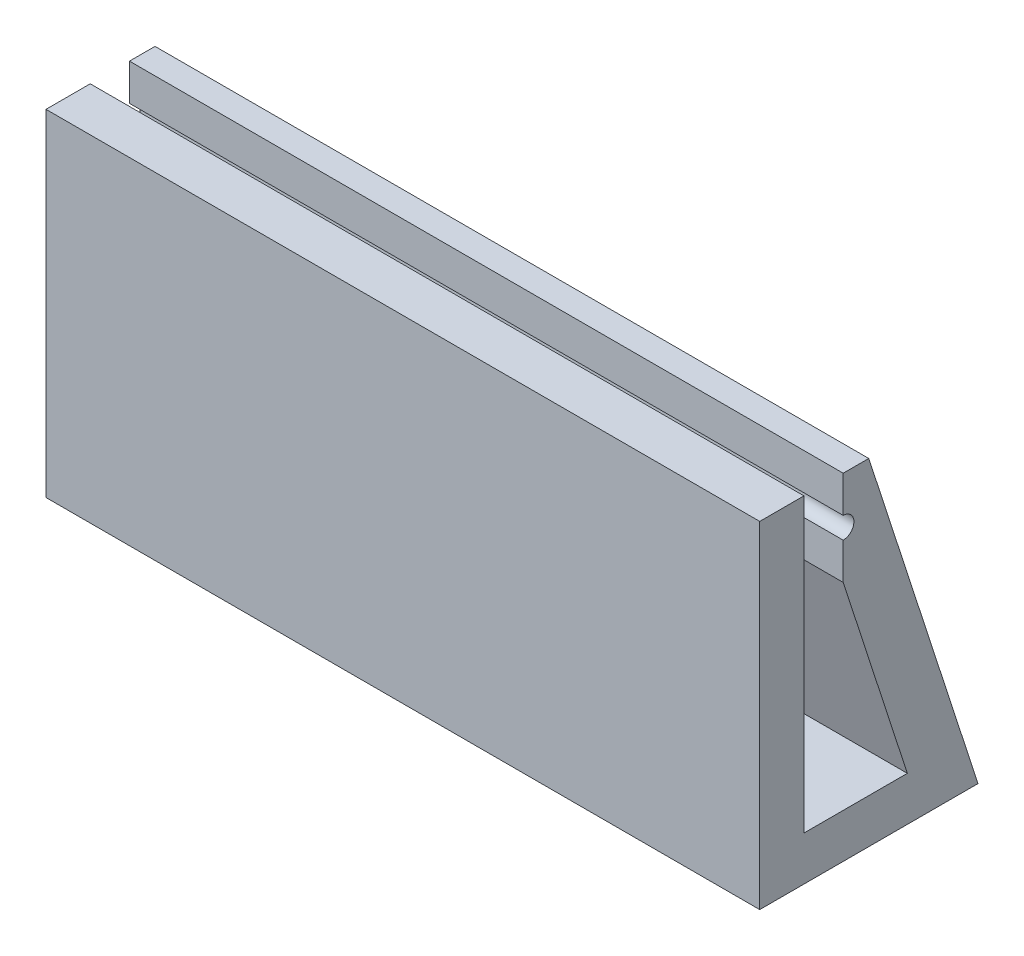
from build123d import *

# Parameters (mm, degrees)
BOSS_EXTRUDE1_DEPTH = 10


with BuildPart() as part:
    # Sketch1 → Boss-Extrude1 (new, symmetric)
    with BuildSketch(Plane(origin=(0, 0, 0), x_dir=(0, 0, -1), z_dir=(1, 0, 0))):
        with BuildLine():
            Line((0, 0), (6.116419195, 0))
            Line((6.116419195, 0), (3.055144814, 9.421633765))
            Line((3.055144814, 9.421633765), (2.339181313, 9.421633765))
            Line((2.339181313, 9.421633765), (2.339181313, 8.396337322))
            ThreePointArc((2.339181313, 8.396337322), (2.639181313, 8.096337322), (2.339181313, 7.796337322))
            Line((2.339181313, 7.796337322), (2.339181313, 6.771040879))
            Line((2.339181313, 6.771040879), (4.136591443, 1.239181313))
            Line((4.136591443, 1.239181313), (1.239181313, 1.239181313))
            Line((1.239181313, 1.239181313), (1.239181313, 9.421633765))
            Line((1.239181313, 9.421633765), (0, 9.421633765))
            Line((0, 9.421633765), (0, 0))
        make_face()
    extrude(amount=BOSS_EXTRUDE1_DEPTH, both=True)


solid = part.part
